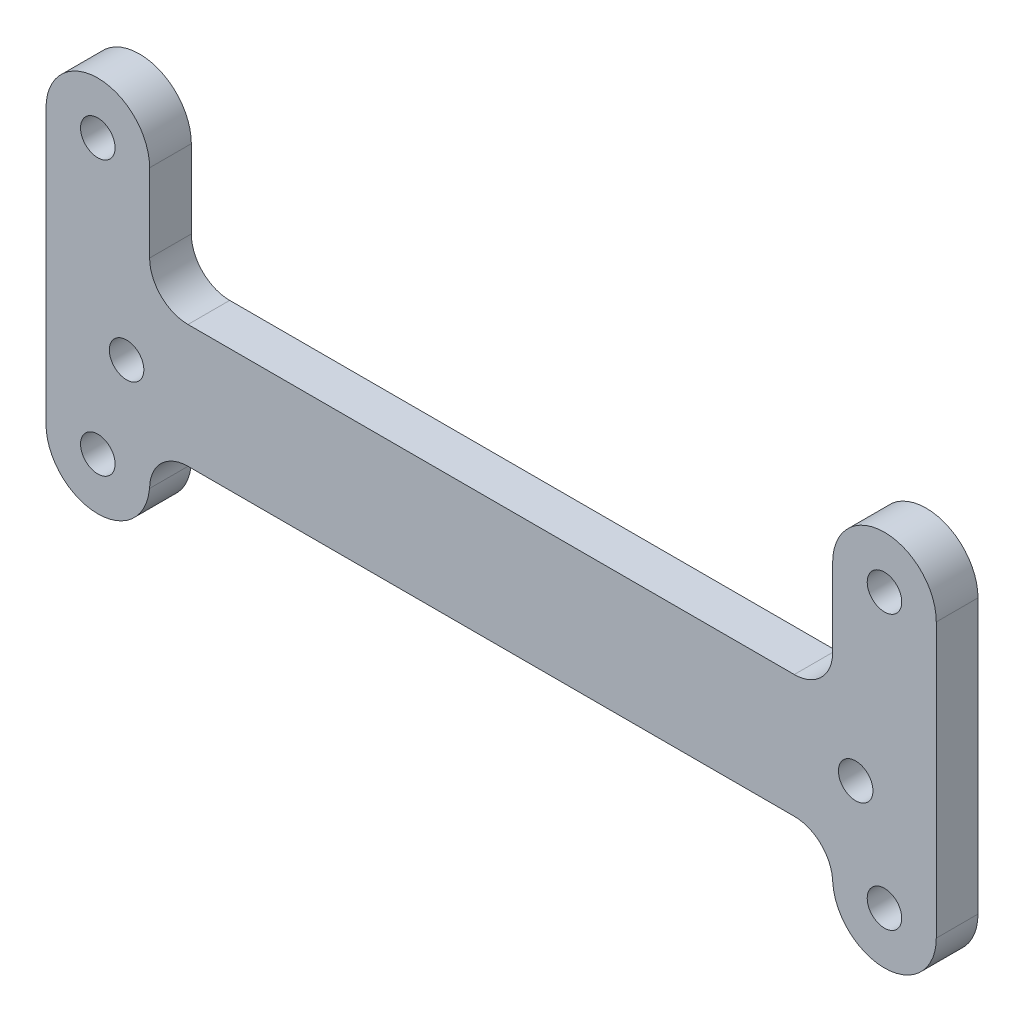
from build123d import *

# Parameters (mm, degrees)
SKETCH2_R           = 2.25
BOSS_EXTRUDE1_DEPTH = 5.4356


with BuildPart() as part:
    # Sketch2 → Boss-Extrude1 (new body)
    with BuildSketch(Plane(origin=(0, 0, 73.0838), x_dir=(-1, 0, 0), z_dir=(0, 0, -1))):
        with BuildLine():
            Line((-39.5, -8), (39.5, -8))
            ThreePointArc((39.5, -8), (43.035533906, -9.464466094), (44.5, -13))
            Line((44.5, -13), (44.5, -12.496398734))
            ThreePointArc((44.5, -12.496398734), (51.25, -19.246398734), (58, -12.496398734))
            Line((58, -12.496398734), (58, 23.184046239))
            ThreePointArc((58, 23.184046239), (51.25, 29.934046239), (44.5, 23.184046239))
            Line((44.5, 23.184046239), (44.5, 13))
            ThreePointArc((44.5, 13), (43.035533906, 9.464466094), (39.5, 8))
            Line((39.5, 8), (-39.5, 8))
            ThreePointArc((-39.5, 8), (-43.035533906, 9.464466094), (-44.5, 13))
            Line((-44.5, 13), (-44.5, 23.184046239))
            ThreePointArc((-44.5, 23.184046239), (-51.25, 29.934046239), (-58, 23.184046239))
            Line((-58, 23.184046239), (-58, -12.496398734))
            ThreePointArc((-58, -12.496398734), (-51.539037503, -19.240207548), (-44.524753386, -13.073943522))
            Line((-44.524753386, -13.073943522), (-44.481664158, -12.572189046))
            ThreePointArc((-44.481664158, -12.572189046), (-42.880898196, -9.316316058), (-39.5, -8))
        make_face()
        with Locations((47.5, 0)):
            Circle(SKETCH2_R, mode=Mode.SUBTRACT)
        with Locations((-47.5, 0)):
            Circle(SKETCH2_R, mode=Mode.SUBTRACT)
        with Locations((51.25, 23.184046239)):
            Circle(SKETCH2_R, mode=Mode.SUBTRACT)
        with Locations((51.25, -12.496398734)):
            Circle(SKETCH2_R, mode=Mode.SUBTRACT)
        with Locations((-51.25, -12.496398734)):
            Circle(SKETCH2_R, mode=Mode.SUBTRACT)
        with Locations((-51.25, 23.184046239)):
            Circle(SKETCH2_R, mode=Mode.SUBTRACT)
    extrude(amount=BOSS_EXTRUDE1_DEPTH)


solid = part.part
